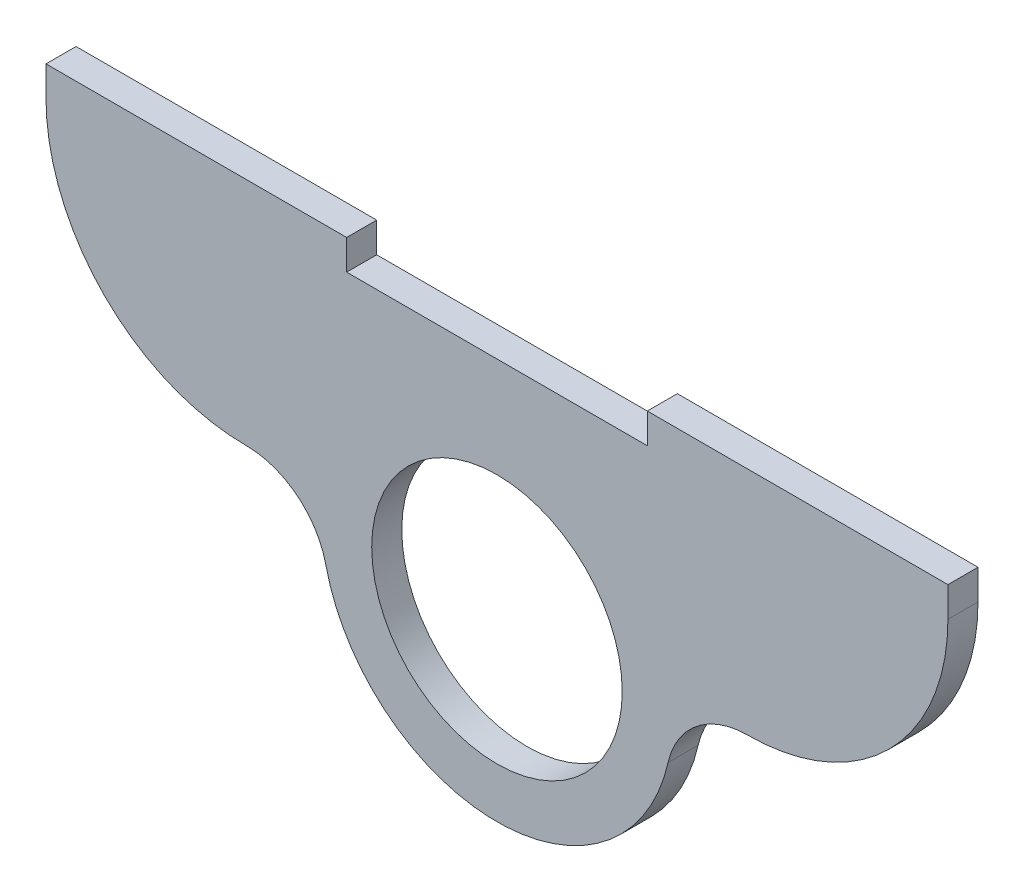
from build123d import *

# Parameters (mm, degrees)
SKETCH1_R           = 12.5
BOSS_EXTRUDE1_DEPTH = 3


with BuildPart() as part:
    # Sketch1 → Boss-Extrude1 (new body)
    with BuildSketch(Plane.XY):
        with BuildLine():
            Line((-15, 22.5), (15, 22.5))
            Line((15, 22.5), (15, 25.5))
            Line((15, 25.5), (45, 25.5))
            Line((45, 25.5), (45, 22.5))
            ThreePointArc((45, 22.5), (39.142135624, 8.357864376), (25, 2.5))
            ThreePointArc((25, 2.5), (19.924352739, 0.719559077), (17.073170732, -3.841463415))
            ThreePointArc((17.073170732, -3.841463415), (0, -17.5), (-17.073170732, -3.841463415))
            ThreePointArc((-17.073170732, -3.841463415), (-19.924352739, 0.719559077), (-25, 2.5))
            ThreePointArc((-25, 2.5), (-39.142135624, 8.357864376), (-45, 22.5))
            Line((-45, 22.5), (-45, 25.5))
            Line((-45, 25.5), (-15, 25.5))
            Line((-15, 25.5), (-15, 22.5))
        make_face()
        Circle(SKETCH1_R, mode=Mode.SUBTRACT)
    extrude(amount=BOSS_EXTRUDE1_DEPTH)


solid = part.part
